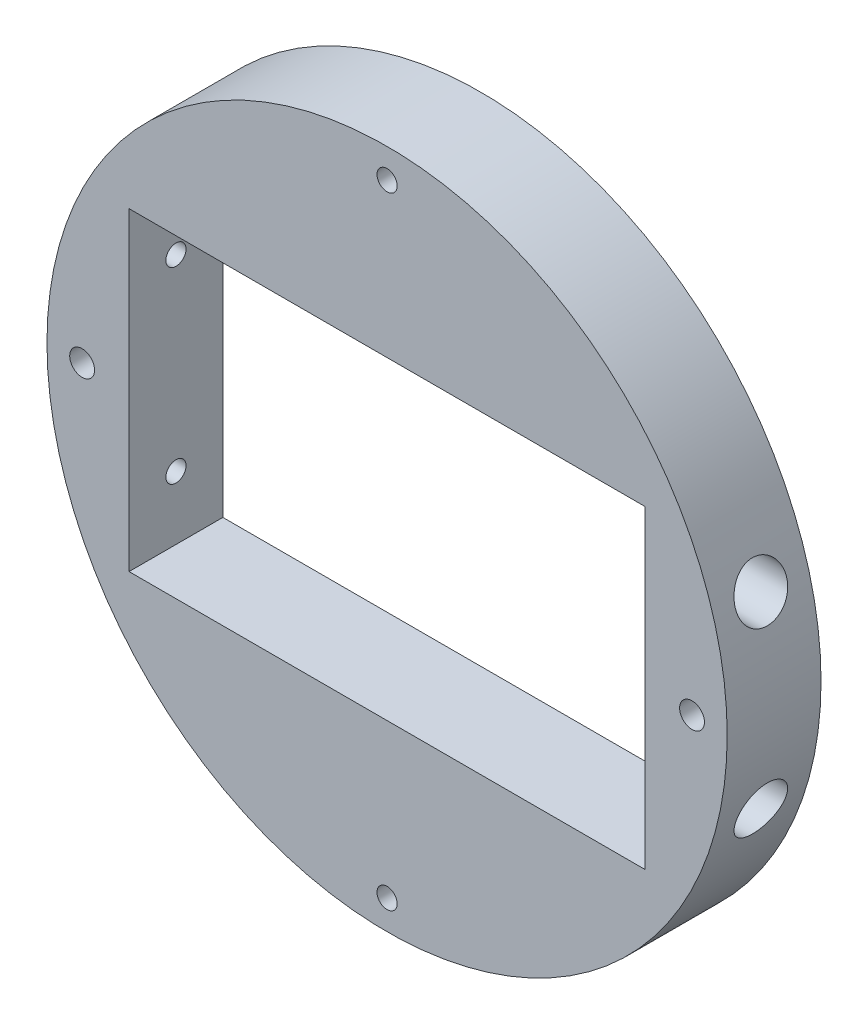
from build123d import *

# Parameters (mm, degrees)
SKETCH_3_R               = 72.5
SKETCH_3_R_2             = 2.15
SKETCH_3_W               = 110
SKETCH_3_H               = 67
SKETCH_3_R_3             = 2.65
EXTRUDE_2_DEPTH          = 20
CUT_EXTRUDE_2_DEPTH      = 149.028713431
CUT_EXTRUDE_2_DEPTH_BACK = 149.028713431
SKETCH_5_R               = 2.15
SKETCH_6_R               = 5.5
CUT_EXTRUDE_4_DEPTH      = 153.35649


with BuildPart() as part:
    # 草图3 → 凸台-拉伸2 (new body)
    with BuildSketch(Plane.XY):
        Circle(SKETCH_3_R)
        with Locations((0, -66.25)):
            Circle(SKETCH_3_R_2, mode=Mode.SUBTRACT)
        Rectangle(SKETCH_3_W, SKETCH_3_H, mode=Mode.SUBTRACT)
        with Locations((0, 66.25)):
            Circle(SKETCH_3_R_2, mode=Mode.SUBTRACT)
        with Locations((65, 0)):
            Circle(SKETCH_3_R_3, mode=Mode.SUBTRACT)
        with Locations((-65, 0)):
            Circle(SKETCH_3_R_3, mode=Mode.SUBTRACT)
    extrude(amount=EXTRUDE_2_DEPTH)

    # 草图5 → 切除-拉伸2 (cut, two sides: drawn at the far end of the back side and taken through both)
    with BuildSketch(Plane(origin=(-55, 0, 0), x_dir=(0, 0, -1), z_dir=(1, 0, 0)).offset(-CUT_EXTRUDE_2_DEPTH_BACK)):
        with Locations((-10, 20)):
            Circle(SKETCH_5_R)
        with Locations((-10, -20)):
            Circle(SKETCH_5_R)
    extrude(amount=CUT_EXTRUDE_2_DEPTH + CUT_EXTRUDE_2_DEPTH_BACK, mode=Mode.SUBTRACT)

    # 草图6 → 切除-拉伸4 (cut, through all)
    with BuildSketch(Plane(origin=(60, 0, 0), x_dir=(0, 0, -1), z_dir=(1, 0, 0))):
        with Locations((-10, 20)):
            Circle(SKETCH_6_R)
        with Locations((-10, -20)):
            Circle(SKETCH_6_R)
    cut_extrude_4 = extrude(amount=CUT_EXTRUDE_4_DEPTH, mode=Mode.SUBTRACT)

    # 镜向1: 切除-拉伸4 across plane
    add(cut_extrude_4.mirror(Plane(origin=(0, 0, 0), x_dir=(0, 0, 1), z_dir=(1, 0, 0))), mode=Mode.SUBTRACT)


solid = part.part
